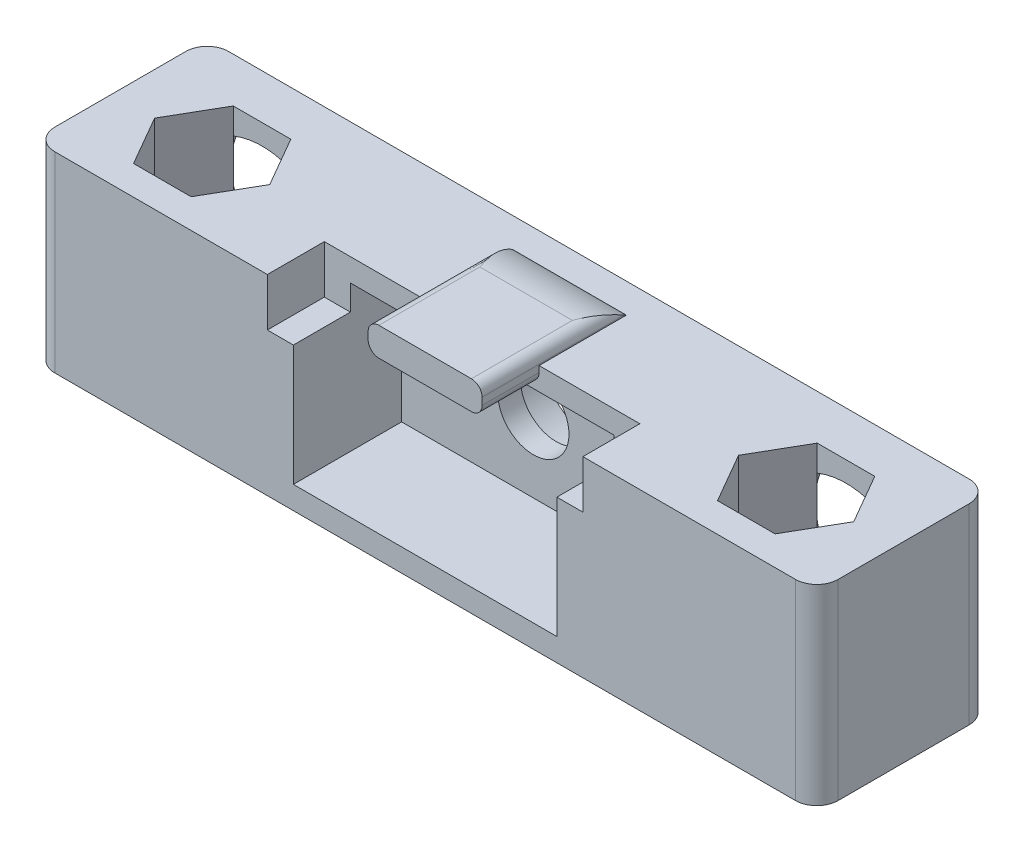
from build123d import *

# Parameters (mm, degrees)
SKETCH2_W           = 55
SKETCH2_H           = 13.45
BOSS_EXTRUDE1_DEPTH = 12.2
SKETCH3_W           = 18.5
SKETCH3_H           = 10.25
CUT_EXTRUDE1_DEPTH  = 7.6
SKETCH5_W           = 22.15
SKETCH5_H           = 1.6
CUT_EXTRUDE2_DEPTH  = 4
SKETCH6_W           = 8
SKETCH6_H           = 2
BOSS_EXTRUDE2_DEPTH = 8.7
SKETCH7_W           = 1.825
SKETCH7_H           = 3.375
CUT_EXTRUDE3_DEPTH  = 4
FILLET1_R           = 0.75
FILLET3_R           = 0.75
DRAFT4_ANGLE        = 60
FILLET5_R           = 6
SKETCH8_R           = 2.5
CUT_EXTRUDE4_DEPTH  = 58.328314378
SKETCH9_R           = 4.25
CUT_EXTRUDE5_DEPTH  = 3
SKETCH10_R          = 5.3
CUT_EXTRUDE6_DEPTH  = 3.15
CUT_EXTRUDE7_DEPTH  = 11
FILLET6_R           = 1.5


with BuildPart() as part:
    # Sketch2 → Boss-Extrude1 (new body)
    with BuildSketch(Plane.XY):
        with Locations((27.5, 6.725)):
            Rectangle(SKETCH2_W, SKETCH2_H)
    extrude(amount=BOSS_EXTRUDE1_DEPTH)

    # Sketch3 → Cut-Extrude1 (cut)
    with BuildSketch(Plane.XY.offset(12.2)):
        with Locations((27.5, 6.725)):
            Rectangle(SKETCH3_W, SKETCH3_H)
    extrude(amount=-CUT_EXTRUDE1_DEPTH, mode=Mode.SUBTRACT)

    # Sketch5 → Cut-Extrude2 (cut)
    with BuildSketch(Plane.XY.offset(12.2)):
        with Locations((27.5, 12.65)):
            Rectangle(SKETCH5_W, SKETCH5_H)
    extrude(amount=-CUT_EXTRUDE2_DEPTH, mode=Mode.SUBTRACT)

    # Sketch6 → Boss-Extrude2 (add)
    with BuildSketch(Plane.XY.offset(12.2)):
        with Locations((27.5, 13.275)):
            Rectangle(SKETCH6_W, SKETCH6_H)
    extrude(amount=-BOSS_EXTRUDE2_DEPTH)

    # Sketch7 → Cut-Extrude3 (cut)
    with BuildSketch(Plane.XY.offset(12.2)):
        with Locations((37.6625, 11.7625)):
            Rectangle(SKETCH7_W, SKETCH7_H)
        with Locations((17.3375, 11.7625)):
            Rectangle(SKETCH7_W, SKETCH7_H)
    extrude(amount=-CUT_EXTRUDE3_DEPTH, mode=Mode.SUBTRACT)

    # Fillet1
    fillet1_edges = [part.edges().sort_by_distance(p)[0] for p in [
        (31.5, 14.275, 7.85),
        (31.5, 12.275, 10.2),
    ]]
    fillet(fillet1_edges, radius=FILLET1_R)

    # Fillet3
    fillet3_edges = [part.edges().sort_by_distance(p)[0] for p in [
        (23.5, 12.275, 10.2),
        (23.5, 14.275, 7.85),
    ]]
    fillet(fillet3_edges, radius=FILLET3_R)

    # Draft4
    draft4_faces = [part.faces().sort_by_distance(p)[0] for p in [
        (27.5, 13.853198642, 3.5),
    ]]
    draft(draft4_faces, Plane(origin=(23.5, 14.275, 3.5), x_dir=(0, 0, 1), z_dir=(0, 1, 0)), DRAFT4_ANGLE)

    # Fillet5
    # the kernel refuses this fillet: 6 mm, written as the material it takes off along each edge
    with BuildSketch(Plane(origin=(34.769237886, 14.275, 3.5), x_dir=(0, -0.49999999999999784, -0.8660254037844399), z_dir=(-1, 0, 0))) as fillet5_piece_1:
        with BuildLine():
            CenterArc((FILLET5_R * 0.267949192431, FILLET5_R), FILLET5_R, 240, 30)
            Line((-FILLET5_R * 0.232050807569, FILLET5_R * 0.133974596216), (0, 0))
            Line((0, 0), (FILLET5_R * 0.267949192431, 0))
        make_face()
    extrude(amount=14.538475773, mode=Mode.SUBTRACT)

    # Sketch8 → Cut-Extrude4 (cut, through all)
    with BuildSketch(Plane.XY.offset(4.6)):
        with Locations((27.5, 6.725)):
            Circle(SKETCH8_R)
    extrude(amount=-CUT_EXTRUDE4_DEPTH, mode=Mode.SUBTRACT)

    # Sketch9 → Cut-Extrude5 (cut)
    with BuildSketch(Plane(origin=(0, 0, 0), x_dir=(-1, 0, 0), z_dir=(0, 0, -1))):
        with Locations((-27.5, 6.725)):
            Circle(SKETCH9_R)
    extrude(amount=-CUT_EXTRUDE5_DEPTH, mode=Mode.SUBTRACT)

    # Sketch10 → Cut-Extrude6 (cut)
    with BuildSketch(Plane(origin=(0, 0, 0), x_dir=(-1, 0, 0), z_dir=(0, 0, -1))):
        with Locations((-48, 6.725)):
            Circle(SKETCH10_R)
        with Locations((-7, 6.725)):
            Circle(SKETCH10_R)
    extrude(amount=-CUT_EXTRUDE6_DEPTH, mode=Mode.SUBTRACT)

    # Sketch11 → Cut-Extrude7 (cut)
    with BuildSketch(Plane(origin=(0, 13.45, 0), x_dir=(1, 0, 0), z_dir=(0, 1, 0))):
        Polygon((9.020725942, -3.15), (4.979274058, -3.15), (2.958548116, -6.65), (4.979274058, -10.15), (9.020725942, -10.15), (11.041451884, -6.65), align=None)
        Polygon((43.958548116, -6.65), (45.979274058, -3.15), (50.020725942, -3.15), (52.041451884, -6.65), (50.020725942, -10.15), (45.979274058, -10.15), align=None)
    extrude(amount=-CUT_EXTRUDE7_DEPTH, mode=Mode.SUBTRACT)

    # Fillet6
    fillet6_edges = [part.edges().sort_by_distance(p)[0] for p in [
        (55, 6.725, 12.2),
        (0, 6.725, 12.2),
        (55, 6.725, 0),
        (0, 6.725, 0),
    ]]
    fillet(fillet6_edges, radius=FILLET6_R)


solid = part.part
